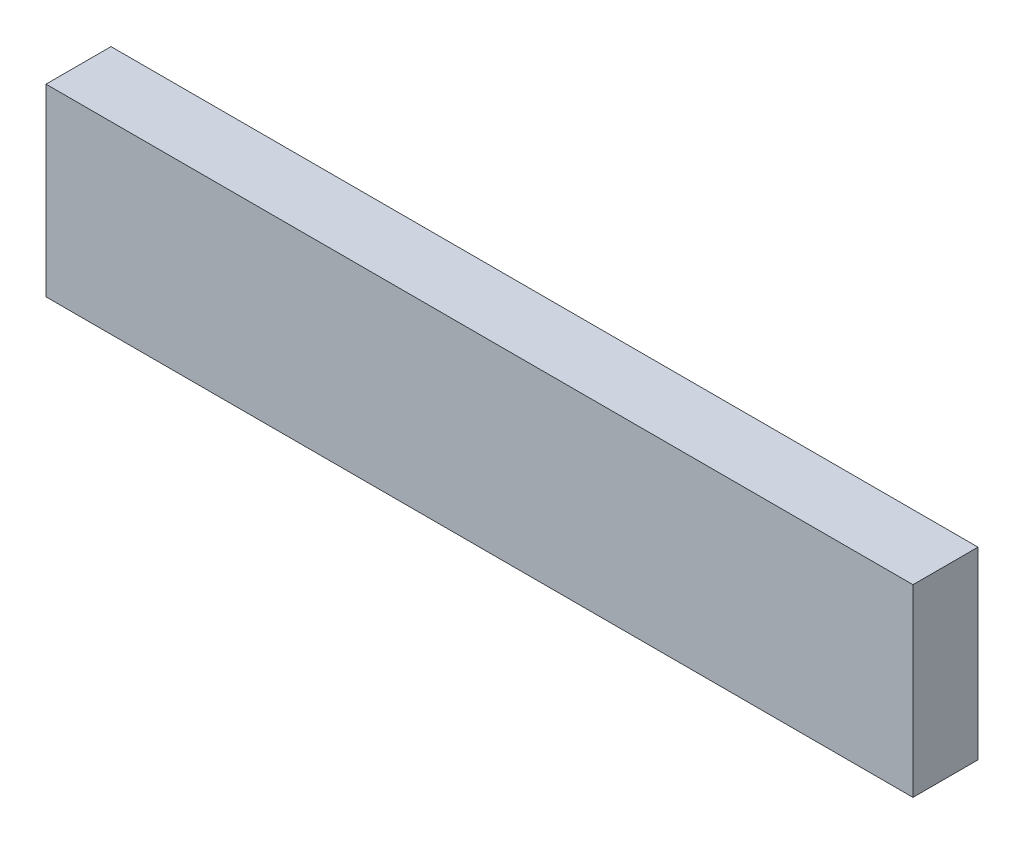
from build123d import *

# Parameters (mm, degrees)
IZIM1_W            = 400
IZIM1_H            = 85
TABAN_FLAN_1_DEPTH = 30


# Sheet-metal steps are written as plain solids
with BuildPart() as part:
    # Çizim1 → Taban-Flanş1 (new body)
    with BuildSketch(Plane.XY):
        with Locations((200, -42.5)):
            Rectangle(IZIM1_W, IZIM1_H)
    extrude(amount=-TABAN_FLAN_1_DEPTH)


solid = part.part
